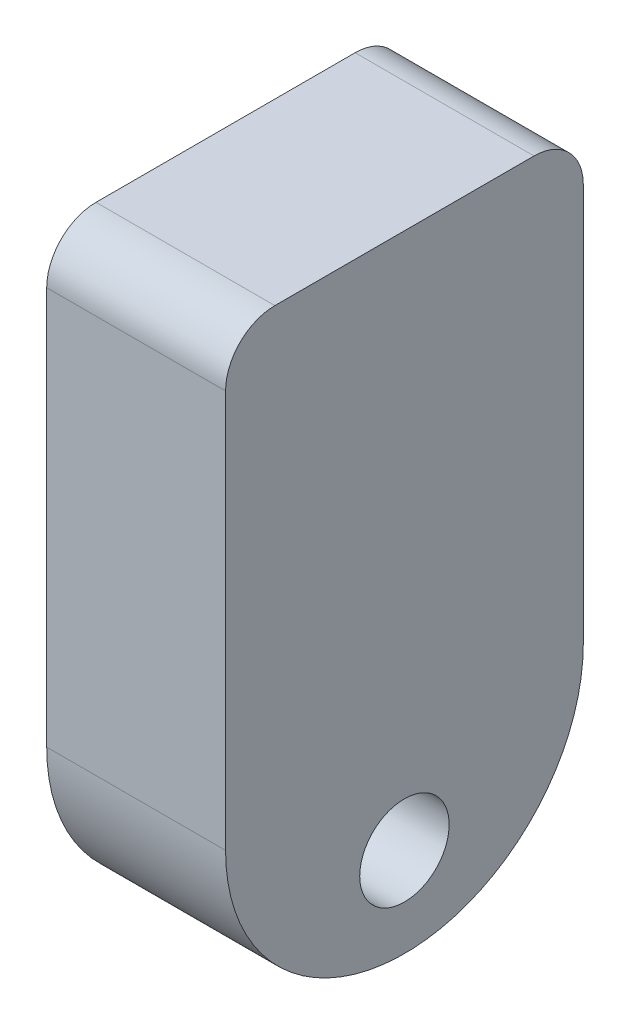
from build123d import *

# Parameters (mm, degrees)
SKETCH1_W               = 50.8
SKETCH1_H               = 88.9
SKETCH1_R               = 6.35
BOSS_EXTRUDE1_DEPTH     = 25.4
BOSS_EXTRUDE2_START     = -1
SKETCH2_R               = 6.35
BOSS_EXTRUDE2_DEPTH     = 1
CUT_EXTRUDE1_DEPTH      = 106.494123059
CUT_EXTRUDE1_DEPTH_BACK = 106.494123059
CUT_EXTRUDE2_DEPTH      = 106.494123059
CUT_EXTRUDE2_DEPTH_BACK = 24.4
SKETCH4_R               = 6.35
FILLET1_R               = 7


with BuildPart() as part:
    # Sketch1 → Boss-Extrude1 (new body)
    with BuildSketch(Plane(origin=(0, 0, 0), x_dir=(0, 0, -1), z_dir=(1, 0, 0))):
        with Locations((25.4, 44.45)):
            Rectangle(SKETCH1_W, SKETCH1_H)
        with Locations((25.4, 63.5)):
            Circle(SKETCH1_R, mode=Mode.SUBTRACT)
    extrude(amount=BOSS_EXTRUDE1_DEPTH)

    # Sketch2 → Boss-Extrude2 (add)
    with BuildSketch(Plane(origin=(25.4, 0, 0), x_dir=(0, 0, -1), z_dir=(1, 0, 0)).offset(BOSS_EXTRUDE2_START)):
        with Locations((25.4, 63.5)):
            Circle(SKETCH2_R)
    extrude(amount=BOSS_EXTRUDE2_DEPTH)

    # Sketch3 → Cut-Extrude1 (cut, two sides: drawn at the far end of the back side and taken through both)
    with BuildSketch(Plane(origin=(25.4, 0, 0), x_dir=(0, 0, -1), z_dir=(1, 0, 0)).offset(-CUT_EXTRUDE1_DEPTH_BACK)):
        with BuildLine():
            ThreePointArc((25.4, 0), (7.439487758, 7.439487758), (0, 25.4))
            Line((0, 25.4), (0, 0))
            Line((0, 0), (25.4, 0))
        make_face()
        with BuildLine():
            Line((50.8, 0), (50.8, 25.4))
            ThreePointArc((50.8, 25.4), (43.360512242, 7.439487758), (25.4, 0))
            Line((25.4, 0), (50.8, 0))
        make_face()
    extrude(amount=CUT_EXTRUDE1_DEPTH + CUT_EXTRUDE1_DEPTH_BACK, mode=Mode.SUBTRACT)

    # Sketch4 → Cut-Extrude2 (cut, two sides: drawn at the far end of the back side and taken through both)
    with BuildSketch(Plane(origin=(25.4, 0, 0), x_dir=(0, 0, -1), z_dir=(1, 0, 0)).offset(-CUT_EXTRUDE2_DEPTH_BACK)):
        with Locations((25.4, 12.7)):
            Circle(SKETCH4_R)
    extrude(amount=CUT_EXTRUDE2_DEPTH + CUT_EXTRUDE2_DEPTH_BACK, mode=Mode.SUBTRACT)

    # Fillet1
    fillet1_edges = [part.edges().sort_by_distance(p)[0] for p in [
        (12.7, 88.9, -50.8),
        (12.7, 88.9, 0),
    ]]
    fillet(fillet1_edges, radius=FILLET1_R)


solid = part.part
